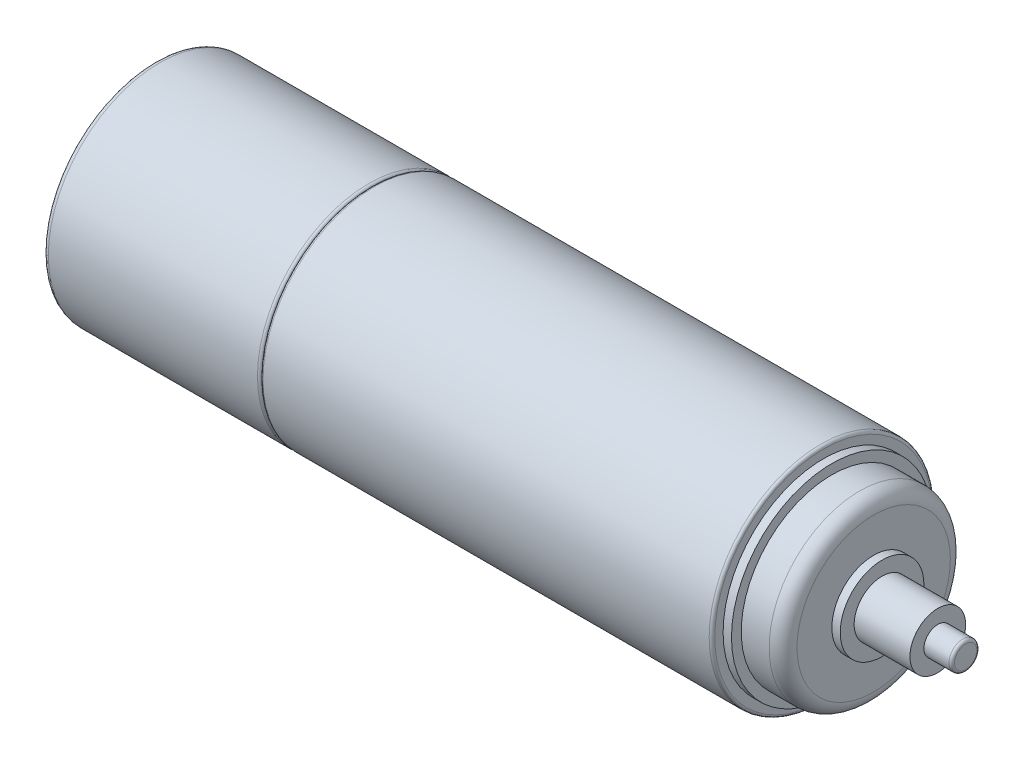
from build123d import *

# Parameters (mm, degrees)
SKETCH1_R           = 4
BOSS_EXTRUDE1_DEPTH = 16.2
SKETCH2_R           = 3.6
BOSS_EXTRUDE2_DEPTH = 0.3
SKETCH3_R           = 3.25
BOSS_EXTRUDE3_DEPTH = 1.5
FILLET1_R           = 0.5
SKETCH4_R           = 1.5
BOSS_EXTRUDE4_DEPTH = 0.3
SKETCH5_R           = 1
BOSS_EXTRUDE5_DEPTH = 2
SKETCH6_R           = 0.5
BOSS_EXTRUDE6_DEPTH = 1
FILLET2_R           = 0.1
FILLET3_R           = 0.1
BOSS_EXTRUDE7_START = 7.8
SKETCH7_R           = 4
BOSS_EXTRUDE7_DEPTH = 7.8
FILLET4_R           = 0.2
FILLET5_R           = 0.1
FILLET6_R           = 0.1


with BuildPart() as part:
    # Sketch1 → Boss-Extrude1 (new body)
    with BuildSketch(Plane(origin=(0, 0, 0), x_dir=(0, 0, -1), z_dir=(1, 0, 0))):
        with Locations((-12.114049009, -15.349356514)):
            Circle(SKETCH1_R)
    extrude(amount=BOSS_EXTRUDE1_DEPTH)

    # Sketch2 → Boss-Extrude2 (add)
    with BuildSketch(Plane(origin=(16.2, 0, 0), x_dir=(0, 0, -1), z_dir=(1, 0, 0))):
        with Locations((-12.114049009, -15.349356514)):
            Circle(SKETCH2_R)
    extrude(amount=BOSS_EXTRUDE2_DEPTH)

    # Sketch3 → Boss-Extrude3 (add)
    with BuildSketch(Plane(origin=(16.5, 0, 0), x_dir=(0, 0, -1), z_dir=(1, 0, 0))):
        with Locations((-12.114049009, -15.349356514)):
            Circle(SKETCH3_R)
    extrude(amount=BOSS_EXTRUDE3_DEPTH)

    # Fillet1
    fillet1_edges = [part.edges().sort_by_distance(p)[0] for p in [
        (18, -15.349356514, 15.364049009),
    ]]
    fillet(fillet1_edges, radius=FILLET1_R)

    # Sketch4 → Boss-Extrude4 (add)
    with BuildSketch(Plane(origin=(18, 0, 0), x_dir=(0, 0, -1), z_dir=(1, 0, 0))):
        with Locations((-12.114049009, -15.349356514)):
            Circle(SKETCH4_R)
    extrude(amount=BOSS_EXTRUDE4_DEPTH)

    # Sketch5 → Boss-Extrude5 (add)
    with BuildSketch(Plane(origin=(18.3, 0, 0), x_dir=(0, 0, -1), z_dir=(1, 0, 0))):
        with Locations((-12.114049009, -15.349356514)):
            Circle(SKETCH5_R)
    extrude(amount=BOSS_EXTRUDE5_DEPTH)

    # Sketch6 → Boss-Extrude6 (add)
    with BuildSketch(Plane(origin=(20.3, 0, 0), x_dir=(0, 0, -1), z_dir=(1, 0, 0))):
        with Locations((-12.114049009, -15.349356514)):
            Circle(SKETCH6_R)
    extrude(amount=BOSS_EXTRUDE6_DEPTH)

    # Fillet2
    fillet2_edges = [part.edges().sort_by_distance(p)[0] for p in [
        (0, -15.349356514, 16.114049009),
    ]]
    fillet(fillet2_edges, radius=FILLET2_R)

    # Fillet3
    fillet3_edges = [part.edges().sort_by_distance(p)[0] for p in [
        (16.2, -15.349356514, 16.114049009),
    ]]
    fillet(fillet3_edges, radius=FILLET3_R)

    # Sketch7 → Boss-Extrude7 (add)
    with BuildSketch(Plane.ZY.offset(BOSS_EXTRUDE7_START)):
        with Locations(Location((12.114049009, -15.349356514, 0), (0, 0, 180))):
            Circle(SKETCH7_R)
    extrude(amount=-BOSS_EXTRUDE7_DEPTH)

    # Fillet4
    fillet4_edges = [part.edges().sort_by_distance(p)[0] for p in [
        (-7.8, -15.349356514, 16.114049009),
    ]]
    fillet(fillet4_edges, radius=FILLET4_R)

    # Fillet5
    fillet5_edges = [part.edges().sort_by_distance(p)[0] for p in [
        (0, -15.349356514, 16.114049009),
    ]]
    fillet(fillet5_edges, radius=FILLET5_R - 0.0001)  # a hair under: the kernel refuses the full size

    # Fillet6
    fillet6_edges = [part.edges().sort_by_distance(p)[0] for p in [
        (21.3, -15.349356514, 12.614049009),
    ]]
    fillet(fillet6_edges, radius=FILLET6_R)


solid = part.part
